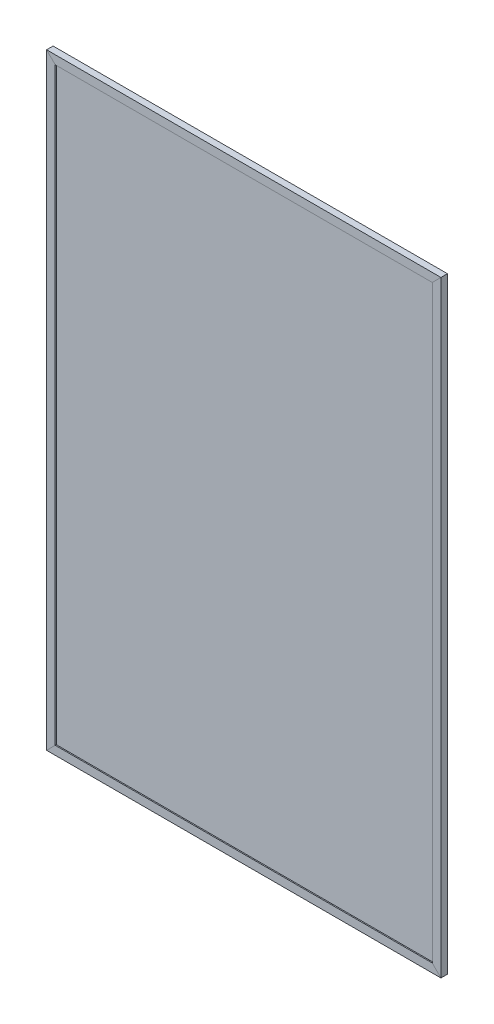
from build123d import *

# Parameters (mm, degrees)
SKETCH2_W               = 577.85
SKETCH2_H               = 889
BOSS_EXTRUDE1_DEPTH     = 4.7625
SKETCH3_W               = 552.45
SKETCH3_H               = 863.6
CUT_EXTRUDE1_DEPTH      = 1052.466816523
CUT_EXTRUDE2_DEPTH      = 3.175
CUT_EXTRUDE2_DEPTH_BACK = 3.175
SKETCH4_W               = 574.675
SKETCH4_H               = 885.825
SPLIT1_START            = -4.7625
SPLIT1_DEPTH            = 9.525
SPLIT1_2_DEPTH          = 1.5875
SPLIT1_START_2          = 3.175
SPLIT1_3_DEPTH          = 1.5875
SPLIT1_START_3          = -3.175
SPLIT1_4_DEPTH          = 6.35
SPLIT1_5_DEPTH          = 1.5875
SPLIT1_6_DEPTH          = 1.5875
SPLIT1_7_DEPTH          = 6.35
SPLIT1_8_DEPTH          = 1.5875
SPLIT1_9_DEPTH          = 1.5875
SPLIT1_10_DEPTH         = 6.35
SKETCH6_W               = 571.5
SKETCH6_H               = 882.65
BOSS_EXTRUDE2_DEPTH     = 3.175


# Read off the part's stored shape, not the designer's step: Split1
with BuildPart() as part:
    # Sketch2 → Boss-Extrude1 (new, symmetric)
    with BuildSketch(Plane.XY):
        with Locations((292.1, 431.8)):
            Rectangle(SKETCH2_W, SKETCH2_H)
    extrude(amount=BOSS_EXTRUDE1_DEPTH, both=True)

    # Sketch3 → Cut-Extrude1 (cut, through all)
    with BuildSketch(Plane.XY.offset(4.7625)):
        with Locations((292.1, 431.8)):
            Rectangle(SKETCH3_W, SKETCH3_H)
    extrude(amount=-CUT_EXTRUDE1_DEPTH, mode=Mode.SUBTRACT)

    # Sketch4 → Cut-Extrude2 (cut, two sides: drawn at the far end of the back side and taken through both)
    with BuildSketch(Plane.XY.offset(-CUT_EXTRUDE2_DEPTH_BACK)):
        with Locations((292.1, 431.8)):
            Rectangle(SKETCH4_W, SKETCH4_H)
    extrude(amount=CUT_EXTRUDE2_DEPTH + CUT_EXTRUDE2_DEPTH_BACK, mode=Mode.SUBTRACT)

    # Split1 outline → Split1 (cut)
    with BuildSketch(Plane.XY.offset(SPLIT1_START)):
        Polygon((581.025, 876.3), (3.175, 876.3), (15.875, 863.6), (568.325, 863.6), (568.325, 0), (15.875, 0), (3.175, -12.7), (581.025, -12.7), align=None)
    extrude(amount=SPLIT1_DEPTH, mode=Mode.SUBTRACT)


with BuildPart() as body_2:
    # Split1 2 outline → Split1 2 (new body)
    with BuildSketch(Plane.XY.offset(SPLIT1_START)):
        Polygon((581.025, 876.3), (3.175, 876.3), (15.875, 863.6), (568.325, 863.6), align=None)
    extrude(amount=SPLIT1_2_DEPTH)

    # Split1 3 outline → Split1 3 (add)
    with BuildSketch(Plane.XY.offset(SPLIT1_START_2)):
        Polygon((581.025, 876.3), (3.175, 876.3), (15.875, 863.6), (568.325, 863.6), align=None)
    extrude(amount=SPLIT1_3_DEPTH)

    # Split1 4 outline → Split1 4 (add)
    with BuildSketch(Plane.XY.offset(SPLIT1_START_3)):
        Polygon((579.4375, 874.7125), (581.025, 876.3), (3.175, 876.3), (4.7625, 874.7125), align=None)
    extrude(amount=SPLIT1_4_DEPTH)


with BuildPart() as body_3:
    # Split1 5 outline → Split1 5 (new body)
    with BuildSketch(Plane.XY.offset(SPLIT1_START)):
        Polygon((581.025, -12.7), (581.025, 876.3), (568.325, 863.6), (568.325, 0), align=None)
    extrude(amount=SPLIT1_5_DEPTH)

    # Split1 6 outline → Split1 6 (add)
    with BuildSketch(Plane.XY.offset(SPLIT1_START_2)):
        Polygon((581.025, -12.7), (581.025, 876.3), (568.325, 863.6), (568.325, 0), align=None)
    extrude(amount=SPLIT1_6_DEPTH)

    # Split1 7 outline → Split1 7 (add)
    with BuildSketch(Plane.XY.offset(SPLIT1_START_3)):
        Polygon((579.4375, -11.1125), (581.025, -12.7), (581.025, 876.3), (579.4375, 874.7125), align=None)
    extrude(amount=SPLIT1_7_DEPTH)


with BuildPart() as body_4:
    # Split1 8 outline → Split1 8 (new body)
    with BuildSketch(Plane.XY.offset(SPLIT1_START)):
        Polygon((3.175, -12.7), (581.025, -12.7), (568.325, 0), (15.875, 0), align=None)
    extrude(amount=SPLIT1_8_DEPTH)

    # Split1 9 outline → Split1 9 (add)
    with BuildSketch(Plane.XY.offset(SPLIT1_START_2)):
        Polygon((3.175, -12.7), (581.025, -12.7), (568.325, 0), (15.875, 0), align=None)
    extrude(amount=SPLIT1_9_DEPTH)

    # Split1 10 outline → Split1 10 (add)
    with BuildSketch(Plane.XY.offset(SPLIT1_START_3)):
        Polygon((4.7625, -11.1125), (3.175, -12.7), (581.025, -12.7), (579.4375, -11.1125), align=None)
    extrude(amount=SPLIT1_10_DEPTH)


with BuildPart() as body_5:
    # Sketch6 → Boss-Extrude2 (new, symmetric)
    with BuildSketch(Plane.XY):
        with Locations((292.1, 431.8)):
            Rectangle(SKETCH6_W, SKETCH6_H)
    extrude(amount=BOSS_EXTRUDE2_DEPTH, both=True)


solid = Compound([part.part, body_2.part, body_3.part, body_4.part, body_5.part])
